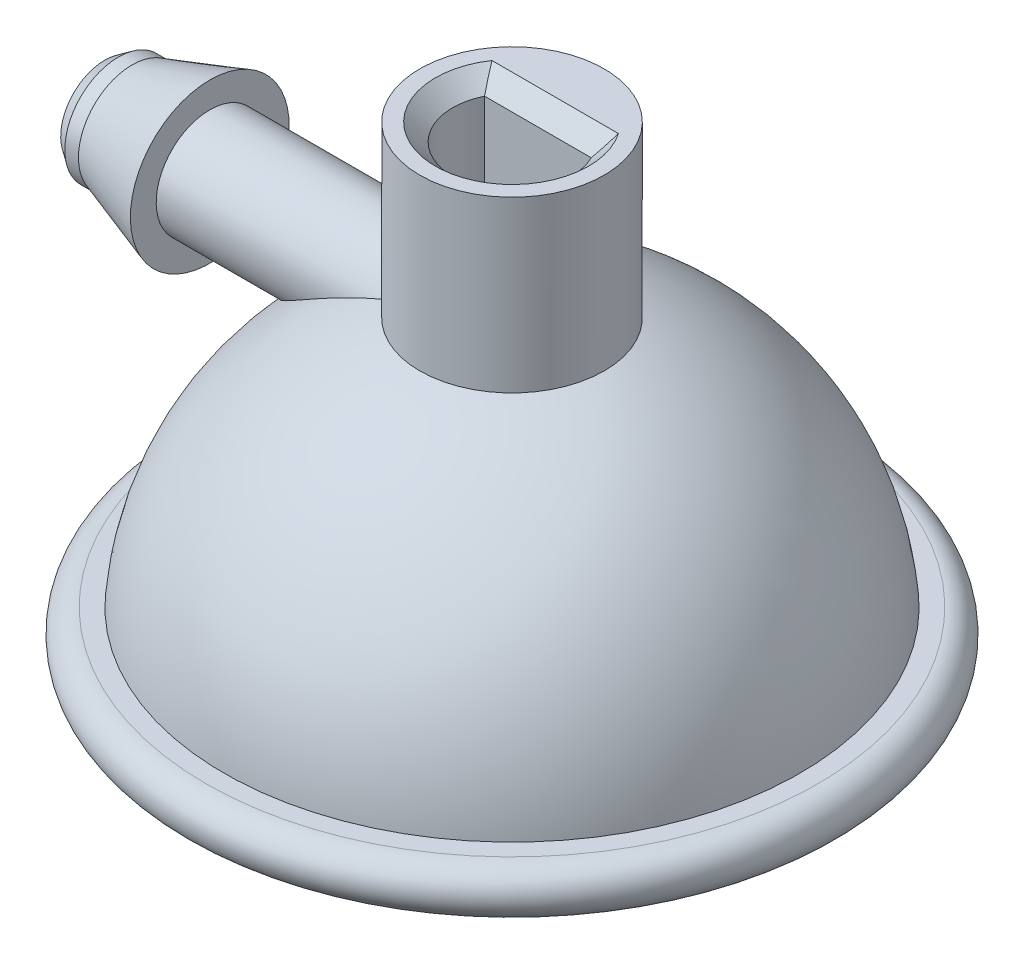
from build123d import *
from build123d.topology import SkipClean

# Parameters (mm, degrees)
BOSS_EXTRUDE2_START      = 2.2
SKETCH7_R                = 0.930249934
SKETCH7_R_2              = 0.6
BOSS_EXTRUDE2_DEPTH      = 2.2
BOSS_EXTRUDE3_DEPTH      = 2.7
BOSS_EXTRUDE3_DEPTH_BACK = 1
SKETCH8_R                = 1.6
CUT_EXTRUDE2_START       = -5.5
SKETCH10_R               = 0.6
CUT_EXTRUDE2_DEPTH       = 5.5
CHAMFER1_SIZE            = 0.3


with BuildPart() as part:
    # Sketch1 → Revolve1 (revolve)
    with BuildSketch(Plane.XY):
        with BuildLine():
            Line((2.497694231, 4.636242165), (2.497694231, 5.015768717))
            ThreePointArc((2.497694231, 5.015768717), (-0.904769349, 3.691451593), (-2.499813377, 0.407184734))
            Line((-2.499813377, 0.407184734), (-2.815131358, 0.408216514))
            ThreePointArc((-2.815131358, 0.408216514), (-3.223347872, 0), (-2.815131358, -0.408216514))
            Line((-2.815131358, -0.408216514), (-2.515131358, -0.408216514))
            ThreePointArc((-2.515131358, -0.408216514), (-2.23135067, -0.285318602), (-2.115133351, 0.001262818))
            ThreePointArc((-2.115133351, 0.001262818), (-0.747635465, 3.253181075), (2.497694231, 4.636242165))
        make_face()
    revolve(axis=Axis((2.497694231, 0, 0), (0, 1, 0)))

    # Sketch5 → Revolve2 (revolve)
    with BuildSketch(Plane.XY):
        Polygon((-0.848304492, 3.399770651), (-0.848304492, 3.730020585), (-4.571479076, 3.730020585), (-4.571479076, 3.564895618), (-4.334897594, 3.399770651), (-4.098316112, 3.399770651), (-2.748304492, 2.951405673), (-2.748304492, 3.399770651), align=None)
    revolve(axis=Axis((-2.145497503, 4.330020585, 0), (-1, 0, 0)))

    # Sketch7 → Boss-Extrude2 (add)
    with SkipClean():  # the faces are left unmerged after this step: merging them gives an invalid solid
        with BuildSketch(Plane(origin=(-0.848304492, 0, 0), x_dir=(0, 0, -1), z_dir=(1, 0, 0)).offset(BOSS_EXTRUDE2_START)):
            with Locations((0, 4.330020585)):
                Circle(SKETCH7_R)
            with Locations((0, 4.330020585)):
                Circle(SKETCH7_R_2, mode=Mode.SUBTRACT)
        extrude(amount=-BOSS_EXTRUDE2_DEPTH)

    # Sketch8 → Boss-Extrude3 (add, two sides: drawn at the far end of the back side and taken through both)
    with SkipClean():  # the faces are left unmerged after this step: merging them gives an invalid solid
        with BuildSketch(Plane(origin=(0, 5, 0), x_dir=(1, 0, 0), z_dir=(0, 1, 0)).offset(-BOSS_EXTRUDE3_DEPTH_BACK)):
            with Locations((2.497694231, 0)):
                Circle(SKETCH8_R)
            with BuildLine():
                Line((1.571195445, 0.45), (3.424193017, 0.45))
                ThreePointArc((3.424193017, 0.45), (2.497694231, -1.03), (1.571195445, 0.45))
            make_face(mode=Mode.SUBTRACT)
        extrude(amount=BOSS_EXTRUDE3_DEPTH + BOSS_EXTRUDE3_DEPTH_BACK)
    add(part.part.scale(1), mode=Mode.REPLACE)  # the faces are merged on a copy

    # Sketch9 → Cut-Revolve2 (revolve, cut)
    with BuildSketch(Plane.XY):
        with BuildLine():
            Line((2.497694231, 0.020218642), (7.110521813, 0.001262818))
            ThreePointArc((7.110521813, 0.001262818), (5.755972652, 3.265135096), (2.497694231, 4.633085172))
            Line((2.497694231, 4.633085172), (2.497694231, 0.020218642))
        make_face()
    revolve(axis=Axis((2.497694231, 0.020218642, 0), (0, 1, 0)), mode=Mode.SUBTRACT)

    # Sketch10 → Cut-Extrude2 (cut)
    with BuildSketch(Plane.ZY.offset(4.571479076).offset(CUT_EXTRUDE2_START)):
        with Locations((0, 4.330020585)):
            Circle(SKETCH10_R)
    extrude(amount=CUT_EXTRUDE2_DEPTH, mode=Mode.SUBTRACT)

    # Chamfer1
    chamfer1_edges = [part.edges().sort_by_distance(p)[0] for p in [
        (2.497694231, 7.7, -0.45),
        (2.497694231, 7.7, 1.03),
    ]]
    chamfer(chamfer1_edges, length=CHAMFER1_SIZE)


solid = part.part
